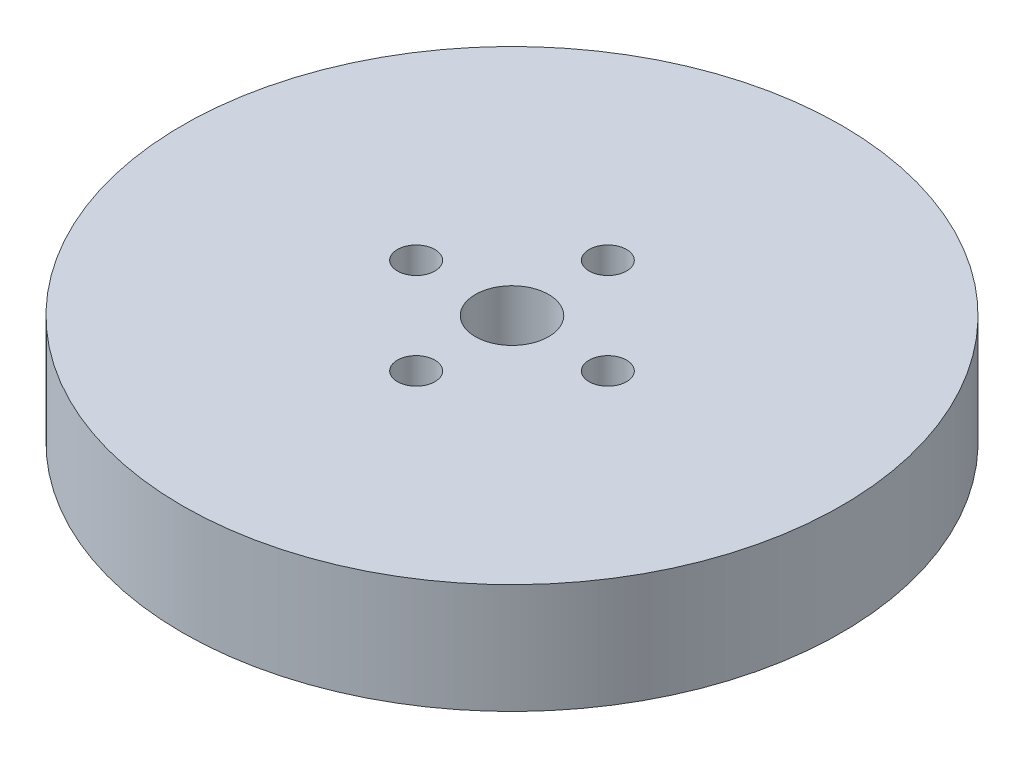
from build123d import *

# Parameters (mm, degrees)
SKETCH1_R           = 90
BOSS_EXTRUDE1_DEPTH = 30
SKETCH2_R           = 10
CUT_EXTRUDE1_DEPTH  = 131.766968306
SKETCH3_R           = 5.119086592
CUT_EXTRUDE2_DEPTH  = 28.785940172
CIRPATTERN1_COUNT   = 4


with BuildPart() as part:
    # Sketch1 → Boss-Extrude1 (new body)
    with BuildSketch(Plane(origin=(0, 0, 0), x_dir=(1, 0, 0), z_dir=(0, 1, 0))):
        Circle(SKETCH1_R)
    extrude(amount=BOSS_EXTRUDE1_DEPTH)

    # Sketch2 → Cut-Extrude1 (cut, through all)
    with BuildSketch(Plane(origin=(0, 0, 0), x_dir=(1, 0, 0), z_dir=(0, 1, 0))):
        Circle(SKETCH2_R)
    extrude(amount=CUT_EXTRUDE1_DEPTH, mode=Mode.SUBTRACT)

    # Sketch3 → Cut-Extrude2 (cut)
    with BuildSketch(Plane(origin=(0, 30, 0), x_dir=(1, 0, 0), z_dir=(0, 1, 0))):
        with Locations((-26.171503319, 0)):
            Circle(SKETCH3_R)
    cut_extrude2 = extrude(amount=-CUT_EXTRUDE2_DEPTH, mode=Mode.SUBTRACT)

    # CirPattern1: Cut-Extrude2 ×4 about axis
    cirpattern1_axis = Axis((0, 0, 0), (0, 1, 0))
    for i in range(1, CIRPATTERN1_COUNT):
        add(cut_extrude2.rotate(cirpattern1_axis, i * 360 / CIRPATTERN1_COUNT), mode=Mode.SUBTRACT)


solid = part.part
